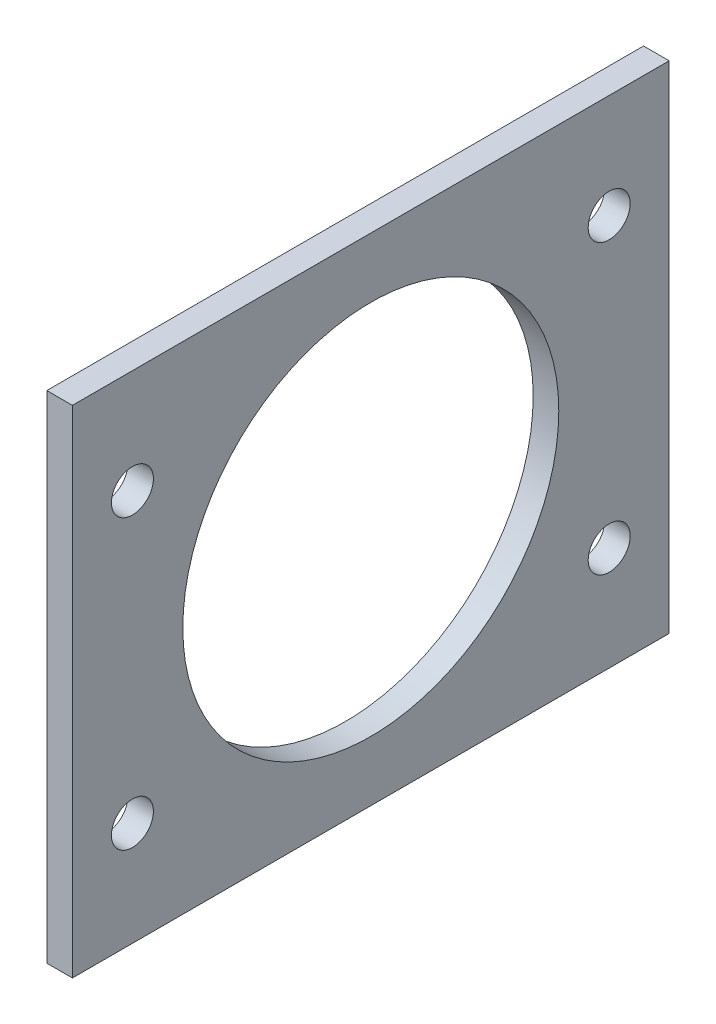
from build123d import *

# Parameters (mm, degrees)
SKETCH1_W           = 74.6
SKETCH1_H           = 62
BOSS_EXTRUDE1_DEPTH = 3.2
CUT_EXTRUDE1_REACH  = 99.054
SKETCH2_R           = 23.5
CUT_EXTRUDE2_REACH  = 99.054
SKETCH3_R           = 2.625


with BuildPart() as part:
    # Sketch1 → Boss-Extrude1 (new body)
    with BuildSketch(Plane(origin=(0, 0, 0), x_dir=(0, 0, -1), z_dir=(1, 0, 0))):
        with Locations((37.3, 31)):
            Rectangle(SKETCH1_W, SKETCH1_H)
    extrude(amount=BOSS_EXTRUDE1_DEPTH)

    # Sketch2 → Cut-Extrude1 (cut, up to next)
    with BuildSketch(Plane(origin=(3.2, 0, 0), x_dir=(0, 0, -1), z_dir=(1, 0, 0)), mode=Mode.PRIVATE) as cut_extrude1_sk1:
        with Locations((37.3, 31)):
            Circle(SKETCH2_R)
    cut_extrude1_tool1 = extrude(cut_extrude1_sk1.sketch, amount=-CUT_EXTRUDE1_REACH, mode=Mode.PRIVATE) & part.part
    add(cut_extrude1_tool1.solids().sort_by_distance((3.2, 31, -37.3))[0], mode=Mode.SUBTRACT)

    # Sketch3 → Cut-Extrude2 (cut, up to next)
    with BuildSketch(Plane.ZY, mode=Mode.PRIVATE) as cut_extrude2_sk1:
        with Locations((-67.1, 13)):
            Circle(SKETCH3_R)
    cut_extrude2_tool1 = extrude(cut_extrude2_sk1.sketch, amount=-CUT_EXTRUDE2_REACH, mode=Mode.PRIVATE) & part.part
    # Sketch3 → Cut-Extrude2 (cut, up to next)
    with BuildSketch(Plane.ZY, mode=Mode.PRIVATE) as cut_extrude2_sk2:
        with Locations((-67.1, 49)):
            Circle(SKETCH3_R)
    cut_extrude2_tool2 = extrude(cut_extrude2_sk2.sketch, amount=-CUT_EXTRUDE2_REACH, mode=Mode.PRIVATE) & part.part
    # Sketch3 → Cut-Extrude2 (cut, up to next)
    with BuildSketch(Plane.ZY, mode=Mode.PRIVATE) as cut_extrude2_sk3:
        with Locations((-7.5, 13)):
            Circle(SKETCH3_R)
    cut_extrude2_tool3 = extrude(cut_extrude2_sk3.sketch, amount=-CUT_EXTRUDE2_REACH, mode=Mode.PRIVATE) & part.part
    # Sketch3 → Cut-Extrude2 (cut, up to next)
    with BuildSketch(Plane.ZY, mode=Mode.PRIVATE) as cut_extrude2_sk4:
        with Locations((-7.5, 49)):
            Circle(SKETCH3_R)
    cut_extrude2_tool4 = extrude(cut_extrude2_sk4.sketch, amount=-CUT_EXTRUDE2_REACH, mode=Mode.PRIVATE) & part.part
    add(cut_extrude2_tool1.solids().sort_by_distance((0, 13, -67.1))[0], mode=Mode.SUBTRACT)
    add(cut_extrude2_tool2.solids().sort_by_distance((0, 49, -67.1))[0], mode=Mode.SUBTRACT)
    add(cut_extrude2_tool3.solids().sort_by_distance((0, 13, -7.5))[0], mode=Mode.SUBTRACT)
    add(cut_extrude2_tool4.solids().sort_by_distance((0, 49, -7.5))[0], mode=Mode.SUBTRACT)


solid = part.part
